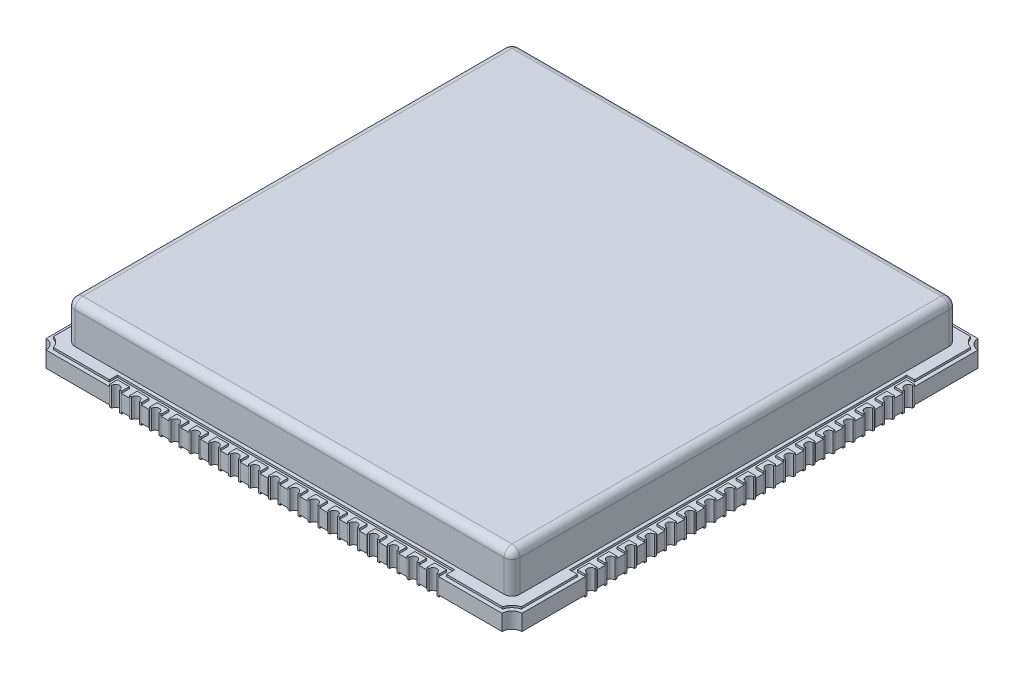
from build123d import *

# Parameters (mm, degrees)
SKETCH_1_W             = 24
SKETCH_1_H             = 24
EXTRUDE_1_DEPTH        = 1
SKETCH_3_R             = 0.5
SKETCH_3_W             = 0.2
SKETCH_3_H             = 0.6
SKETCH_3_W_2           = 0.6
SKETCH_3_H_2           = 0.2
CUT_EXTRUDE_3_DEPTH    = 18
SKETCH_4_OUTSIDE_W     = 32.792
SKETCH_4_OUTSIDE_H     = 32.792
CUT_EXTRUDE_4_DEPTH    = 0.1
SKETCH_5_OUTSIDE_W     = 32.792
SKETCH_5_OUTSIDE_H     = 32.792
SKETCH_5_OUTSIDE_R     = 1.5
SKETCH_5_OUTSIDE_R_2   = 0.75
CUT_EXTRUDE_5_DEPTH    = 0.1
EXTRUDE_7_DEPTH        = 0.3
EXTRUDE_8_DEPTH        = 0.3
PATTERN_LINEAR_1_COUNT = 17
PATTERN_LINEAR_1_PITCH = 1
PATTERN_LINEAR_2_COUNT = 17
PATTERN_LINEAR_2_PITCH = 1
SKETCH_11_R            = 0.2
CUT_EXTRUDE_9_DEPTH    = 18
SKETCH_12_R            = 0.55
SKETCH_12_R_2          = 1.3
EXTRUDE_10_DEPTH       = 0.1
SKETCH_2_W             = 22.44
SKETCH_2_H             = 22.44
EXTRUDE_2_DEPTH        = 2
FILLET_1_R             = 0.4


with BuildPart() as part:
    # Эскиз1 → Вытянуть1 (new body)
    with BuildSketch(Plane(origin=(0, 0, 0), x_dir=(1, 0, 0), z_dir=(0, 1, 0))):
        Rectangle(SKETCH_1_W, SKETCH_1_H)
    extrude(amount=EXTRUDE_1_DEPTH)

    # Эскиз3 → Вытянуть3 (cut, through all)
    with BuildSketch(Plane(origin=(0, 1, 0), x_dir=(1, 0, 0), z_dir=(0, 1, 0))):
        with Locations((-12, 12)):
            Circle(SKETCH_3_R)
        with Locations((12, 12)):
            Circle(SKETCH_3_R)
        with Locations((12, -12)):
            Circle(SKETCH_3_R)
        with Locations((-12, -12)):
            Circle(SKETCH_3_R)
        with Locations((-11.9, 8)):
            Rectangle(SKETCH_3_W, SKETCH_3_H)
        with Locations((-8, 11.9)):
            Rectangle(SKETCH_3_W_2, SKETCH_3_H_2)
        with Locations((-7, 11.9)):
            Rectangle(SKETCH_3_W_2, SKETCH_3_H_2)
        with Locations((-6, 11.9)):
            Rectangle(SKETCH_3_W_2, SKETCH_3_H_2)
        with Locations((-5, 11.9)):
            Rectangle(SKETCH_3_W_2, SKETCH_3_H_2)
        with Locations((-4, 11.9)):
            Rectangle(SKETCH_3_W_2, SKETCH_3_H_2)
        with Locations((-3, 11.9)):
            Rectangle(SKETCH_3_W_2, SKETCH_3_H_2)
        with Locations((-2, 11.9)):
            Rectangle(SKETCH_3_W_2, SKETCH_3_H_2)
        with Locations((-1, 11.9)):
            Rectangle(SKETCH_3_W_2, SKETCH_3_H_2)
        with Locations((0, 11.9)):
            Rectangle(SKETCH_3_W_2, SKETCH_3_H_2)
        with Locations((1, 11.9)):
            Rectangle(SKETCH_3_W_2, SKETCH_3_H_2)
        with Locations((2, 11.9)):
            Rectangle(SKETCH_3_W_2, SKETCH_3_H_2)
        with Locations((3, 11.9)):
            Rectangle(SKETCH_3_W_2, SKETCH_3_H_2)
        with Locations((4, 11.9)):
            Rectangle(SKETCH_3_W_2, SKETCH_3_H_2)
        with Locations((5, 11.9)):
            Rectangle(SKETCH_3_W_2, SKETCH_3_H_2)
        with Locations((6, 11.9)):
            Rectangle(SKETCH_3_W_2, SKETCH_3_H_2)
        with Locations((7, 11.9)):
            Rectangle(SKETCH_3_W_2, SKETCH_3_H_2)
        with Locations((8, 11.9)):
            Rectangle(SKETCH_3_W_2, SKETCH_3_H_2)
        with Locations((-8, -11.9)):
            Rectangle(SKETCH_3_W_2, SKETCH_3_H_2)
        with Locations((-7, -11.9)):
            Rectangle(SKETCH_3_W_2, SKETCH_3_H_2)
        with Locations((-6, -11.9)):
            Rectangle(SKETCH_3_W_2, SKETCH_3_H_2)
        with Locations((-5, -11.9)):
            Rectangle(SKETCH_3_W_2, SKETCH_3_H_2)
        with Locations((-4, -11.9)):
            Rectangle(SKETCH_3_W_2, SKETCH_3_H_2)
        with Locations((-3, -11.9)):
            Rectangle(SKETCH_3_W_2, SKETCH_3_H_2)
        with Locations((-2, -11.9)):
            Rectangle(SKETCH_3_W_2, SKETCH_3_H_2)
        with Locations((-1, -11.9)):
            Rectangle(SKETCH_3_W_2, SKETCH_3_H_2)
        with Locations((0, -11.9)):
            Rectangle(SKETCH_3_W_2, SKETCH_3_H_2)
        with Locations((1, -11.9)):
            Rectangle(SKETCH_3_W_2, SKETCH_3_H_2)
        with Locations((2, -11.9)):
            Rectangle(SKETCH_3_W_2, SKETCH_3_H_2)
        with Locations((3, -11.9)):
            Rectangle(SKETCH_3_W_2, SKETCH_3_H_2)
        with Locations((4, -11.9)):
            Rectangle(SKETCH_3_W_2, SKETCH_3_H_2)
        with Locations((5, -11.9)):
            Rectangle(SKETCH_3_W_2, SKETCH_3_H_2)
        with Locations((6, -11.9)):
            Rectangle(SKETCH_3_W_2, SKETCH_3_H_2)
        with Locations((7, -11.9)):
            Rectangle(SKETCH_3_W_2, SKETCH_3_H_2)
        with Locations((8, -11.9)):
            Rectangle(SKETCH_3_W_2, SKETCH_3_H_2)
        with Locations((11.9, 8)):
            Rectangle(SKETCH_3_W, SKETCH_3_H)
        with Locations((-11.9, 7)):
            Rectangle(SKETCH_3_W, SKETCH_3_H)
        with Locations((11.9, 7)):
            Rectangle(SKETCH_3_W, SKETCH_3_H)
        with Locations((-11.9, 6)):
            Rectangle(SKETCH_3_W, SKETCH_3_H)
        with Locations((11.9, 6)):
            Rectangle(SKETCH_3_W, SKETCH_3_H)
        with Locations((-11.9, 5)):
            Rectangle(SKETCH_3_W, SKETCH_3_H)
        with Locations((11.9, 5)):
            Rectangle(SKETCH_3_W, SKETCH_3_H)
        with Locations((-11.9, 4)):
            Rectangle(SKETCH_3_W, SKETCH_3_H)
        with Locations((11.9, 4)):
            Rectangle(SKETCH_3_W, SKETCH_3_H)
        with Locations((-11.9, 3)):
            Rectangle(SKETCH_3_W, SKETCH_3_H)
        with Locations((11.9, 3)):
            Rectangle(SKETCH_3_W, SKETCH_3_H)
        with Locations((-11.9, 2)):
            Rectangle(SKETCH_3_W, SKETCH_3_H)
        with Locations((11.9, 2)):
            Rectangle(SKETCH_3_W, SKETCH_3_H)
        with Locations((-11.9, 1)):
            Rectangle(SKETCH_3_W, SKETCH_3_H)
        with Locations((11.9, 1)):
            Rectangle(SKETCH_3_W, SKETCH_3_H)
        with Locations((-11.9, 0)):
            Rectangle(SKETCH_3_W, SKETCH_3_H)
        with Locations((11.9, 0)):
            Rectangle(SKETCH_3_W, SKETCH_3_H)
        with Locations((-11.9, -1)):
            Rectangle(SKETCH_3_W, SKETCH_3_H)
        with Locations((11.9, -1)):
            Rectangle(SKETCH_3_W, SKETCH_3_H)
        with Locations((-11.9, -2)):
            Rectangle(SKETCH_3_W, SKETCH_3_H)
        with Locations((11.9, -2)):
            Rectangle(SKETCH_3_W, SKETCH_3_H)
        with Locations((-11.9, -3)):
            Rectangle(SKETCH_3_W, SKETCH_3_H)
        with Locations((11.9, -3)):
            Rectangle(SKETCH_3_W, SKETCH_3_H)
        with Locations((-11.9, -4)):
            Rectangle(SKETCH_3_W, SKETCH_3_H)
        with Locations((11.9, -4)):
            Rectangle(SKETCH_3_W, SKETCH_3_H)
        with Locations((-11.9, -5)):
            Rectangle(SKETCH_3_W, SKETCH_3_H)
        with Locations((11.9, -5)):
            Rectangle(SKETCH_3_W, SKETCH_3_H)
        with Locations((-11.9, -6)):
            Rectangle(SKETCH_3_W, SKETCH_3_H)
        with Locations((11.9, -6)):
            Rectangle(SKETCH_3_W, SKETCH_3_H)
        with Locations((-11.9, -7)):
            Rectangle(SKETCH_3_W, SKETCH_3_H)
        with Locations((11.9, -7)):
            Rectangle(SKETCH_3_W, SKETCH_3_H)
        with Locations((-11.9, -8)):
            Rectangle(SKETCH_3_W, SKETCH_3_H)
        with Locations((11.9, -8)):
            Rectangle(SKETCH_3_W, SKETCH_3_H)
    extrude(amount=-CUT_EXTRUDE_3_DEPTH, mode=Mode.SUBTRACT)

    # Эскиз4 outside → Вытянуть4 (cut)
    with BuildSketch(Plane(origin=(0, 1, 0), x_dir=(1, 0, 0), z_dir=(0, 1, 0))):
        Rectangle(SKETCH_4_OUTSIDE_W, SKETCH_4_OUTSIDE_H)
        with BuildLine():
            Line((-11.8, -8.5), (-11.8, -11.329179607))
            ThreePointArc((-11.8, -11.329179607), (-11.505025253, -11.505025253), (-11.329179607, -11.8))
            Line((-11.329179607, -11.8), (-8.5, -11.8))
            Line((-8.5, -11.8), (-8.5, -11.4))
            Line((-8.5, -11.4), (8.5, -11.4))
            Line((8.5, -11.4), (8.5, -11.8))
            Line((8.5, -11.8), (11.329179607, -11.8))
            ThreePointArc((11.329179607, -11.8), (11.505025253, -11.505025253), (11.8, -11.329179607))
            Line((11.8, -11.329179607), (11.8, -8.5))
            Line((11.8, -8.5), (11.4, -8.5))
            Line((11.4, -8.5), (11.4, 8.5))
            Line((11.4, 8.5), (11.8, 8.5))
            Line((11.8, 8.5), (11.8, 11.329179607))
            ThreePointArc((11.8, 11.329179607), (11.505025253, 11.505025253), (11.329179607, 11.8))
            Line((11.329179607, 11.8), (8.5, 11.8))
            Line((8.5, 11.8), (8.5, 11.4))
            Line((8.5, 11.4), (-8.5, 11.4))
            Line((-8.5, 11.4), (-8.5, 11.8))
            Line((-8.5, 11.8), (-11.329179607, 11.8))
            ThreePointArc((-11.329179607, 11.8), (-11.505025253, 11.505025253), (-11.8, 11.329179607))
            Line((-11.8, 11.329179607), (-11.8, 8.5))
            Line((-11.8, 8.5), (-11.4, 8.5))
            Line((-11.4, 8.5), (-11.4, -8.5))
            Line((-11.4, -8.5), (-11.8, -8.5))
        make_face(mode=Mode.SUBTRACT)
    extrude(amount=-CUT_EXTRUDE_4_DEPTH, mode=Mode.SUBTRACT)

    # Эскиз5 outside → Вытянуть5 (cut)
    # profile 1 of 11: a face of its own
    with BuildSketch(Plane.XZ):
        Rectangle(SKETCH_5_OUTSIDE_W, SKETCH_5_OUTSIDE_H)
        with BuildLine():
            Line((-8.5, -10.8), (8.5, -10.8))
            Line((8.5, -10.8), (8.5, -11.8))
            Line((8.5, -11.8), (11.329179607, -11.8))
            ThreePointArc((11.329179607, -11.8), (11.505025253, -11.505025253), (11.8, -11.329179607))
            Line((11.8, -11.329179607), (11.8, -8.5))
            Line((11.8, -8.5), (10.8, -8.5))
            Line((10.8, -8.5), (10.8, 8.5))
            Line((10.8, 8.5), (11.8, 8.5))
            Line((11.8, 8.5), (11.8, 11.329179607))
            ThreePointArc((11.8, 11.329179607), (11.505025253, 11.505025253), (11.329179607, 11.8))
            Line((11.329179607, 11.8), (8.5, 11.8))
            Line((8.5, 11.8), (8.5, 10.8))
            Line((8.5, 10.8), (-8.5, 10.8))
            Line((-8.5, 10.8), (-8.5, 11.8))
            Line((-8.5, 11.8), (-11.329179607, 11.8))
            ThreePointArc((-11.329179607, 11.8), (-11.505025253, 11.505025253), (-11.8, 11.329179607))
            Line((-11.8, 11.329179607), (-11.8, 8.5))
            Line((-11.8, 8.5), (-10.8, 8.5))
            Line((-10.8, 8.5), (-10.8, -8.5))
            Line((-10.8, -8.5), (-11.8, -8.5))
            Line((-11.8, -8.5), (-11.8, -11.329179607))
            ThreePointArc((-11.8, -11.329179607), (-11.505025253, -11.505025253), (-11.329179607, -11.8))
            Line((-11.329179607, -11.8), (-8.5, -11.8))
            Line((-8.5, -11.8), (-8.5, -10.8))
        make_face(mode=Mode.SUBTRACT)
    # profile 2 of 11: a face of its own
    with BuildSketch(Plane.XZ):
        with Locations((-0.5, -8)):
            Circle(SKETCH_5_OUTSIDE_R)
    # profile 3 of 11: a face of its own
    with BuildSketch(Plane.XZ):
        with Locations((-6.5, 2)):
            Circle(SKETCH_5_OUTSIDE_R_2)
    # profile 4 of 11: a face of its own
    with BuildSketch(Plane.XZ):
        with Locations((-4.5, 2)):
            Circle(SKETCH_5_OUTSIDE_R_2)
    # profile 5 of 11: a face of its own
    with BuildSketch(Plane.XZ):
        with Locations((-2.5, 2)):
            Circle(SKETCH_5_OUTSIDE_R_2)
    # profile 6 of 11: a face of its own
    with BuildSketch(Plane.XZ):
        with Locations((-6.5, 0)):
            Circle(SKETCH_5_OUTSIDE_R_2)
    # profile 7 of 11: a face of its own
    with BuildSketch(Plane.XZ):
        with Locations((-4.5, 0)):
            Circle(SKETCH_5_OUTSIDE_R_2)
    # profile 8 of 11: a face of its own
    with BuildSketch(Plane.XZ):
        with Locations((-2.5, 0)):
            Circle(SKETCH_5_OUTSIDE_R_2)
    # profile 9 of 11: a face of its own
    with BuildSketch(Plane.XZ):
        with Locations((-6.5, -2)):
            Circle(SKETCH_5_OUTSIDE_R_2)
    # profile 10 of 11: a face of its own
    with BuildSketch(Plane.XZ):
        with Locations((-4.5, -2)):
            Circle(SKETCH_5_OUTSIDE_R_2)
    # profile 11 of 11: a face of its own
    with BuildSketch(Plane.XZ):
        with Locations((-2.5, -2)):
            Circle(SKETCH_5_OUTSIDE_R_2)
    extrude(amount=-CUT_EXTRUDE_5_DEPTH, mode=Mode.SUBTRACT)

    # Эскиз9 → Вытянуть7 (add, symmetric)
    with BuildSketch(Plane.XY.offset(-8)):
        Polygon((-11.99, 1), (-11.99, 0), (-11, 0), (-11, 0.1), (-11.6, 0.1), (-11.6, 1), align=None)
        Polygon((11.6, 1), (11.99, 1), (11.99, 0), (11, 0), (11, 0.1), (11.6, 0.1), align=None)
    extrude_7 = extrude(amount=EXTRUDE_7_DEPTH, both=True)

    # Эскиз10 → Вытянуть8 (add, symmetric)
    with BuildSketch(Plane(origin=(-8, 0, 0), x_dir=(0, 0, -1), z_dir=(1, 0, 0))):
        Polygon((11.6, 0.1), (11.6, 1), (11.99, 1), (11.99, 0), (11, 0), (11, 0.1), align=None)
        Polygon((-11, 0.1), (-11.6, 0.1), (-11.6, 1), (-11.99, 1), (-11.99, 0), (-11, 0), align=None)
    extrude_8 = extrude(amount=EXTRUDE_8_DEPTH, both=True)

    # Линейный массив1: Вытянуть7 ×17
    with Locations(*[(0, 0, i * PATTERN_LINEAR_1_PITCH) for i in range(1, PATTERN_LINEAR_1_COUNT)]):
        add(extrude_7)

    # Линейный массив2: Вытянуть8 ×17
    with Locations(*[(i * PATTERN_LINEAR_2_PITCH, 0, 0) for i in range(1, PATTERN_LINEAR_2_COUNT)]):
        add(extrude_8)

    # Эскиз11 → Вытянуть9 (cut, through all)
    with BuildSketch(Plane(origin=(0, 1, 0), x_dir=(1, 0, 0), z_dir=(0, 1, 0))):
        with Locations((-11.99, 8)):
            Circle(SKETCH_11_R)
        with Locations((-8, 11.99)):
            Circle(SKETCH_11_R)
        with Locations((11.99, 8)):
            Circle(SKETCH_11_R)
        with Locations((-11.99, 7)):
            Circle(SKETCH_11_R)
        with Locations((11.99, 7)):
            Circle(SKETCH_11_R)
        with Locations((-11.99, 6)):
            Circle(SKETCH_11_R)
        with Locations((11.99, 6)):
            Circle(SKETCH_11_R)
        with Locations((-11.99, 5)):
            Circle(SKETCH_11_R)
        with Locations((11.99, 5)):
            Circle(SKETCH_11_R)
        with Locations((-11.99, 4)):
            Circle(SKETCH_11_R)
        with Locations((11.99, 4)):
            Circle(SKETCH_11_R)
        with Locations((-11.99, 3)):
            Circle(SKETCH_11_R)
        with Locations((11.99, 3)):
            Circle(SKETCH_11_R)
        with Locations((-11.99, 2)):
            Circle(SKETCH_11_R)
        with Locations((11.99, 2)):
            Circle(SKETCH_11_R)
        with Locations((-11.99, 1)):
            Circle(SKETCH_11_R)
        with Locations((11.99, 1)):
            Circle(SKETCH_11_R)
        with Locations((-11.99, 0)):
            Circle(SKETCH_11_R)
        with Locations((11.99, 0)):
            Circle(SKETCH_11_R)
        with Locations((-11.99, -1)):
            Circle(SKETCH_11_R)
        with Locations((11.99, -1)):
            Circle(SKETCH_11_R)
        with Locations((-11.99, -2)):
            Circle(SKETCH_11_R)
        with Locations((11.99, -2)):
            Circle(SKETCH_11_R)
        with Locations((-11.99, -3)):
            Circle(SKETCH_11_R)
        with Locations((11.99, -3)):
            Circle(SKETCH_11_R)
        with Locations((-11.99, -4)):
            Circle(SKETCH_11_R)
        with Locations((11.99, -4)):
            Circle(SKETCH_11_R)
        with Locations((-11.99, -5)):
            Circle(SKETCH_11_R)
        with Locations((11.99, -5)):
            Circle(SKETCH_11_R)
        with Locations((-11.99, -6)):
            Circle(SKETCH_11_R)
        with Locations((11.99, -6)):
            Circle(SKETCH_11_R)
        with Locations((-11.99, -7)):
            Circle(SKETCH_11_R)
        with Locations((11.99, -7)):
            Circle(SKETCH_11_R)
        with Locations((-11.99, -8)):
            Circle(SKETCH_11_R)
        with Locations((11.99, -8)):
            Circle(SKETCH_11_R)
        with Locations((-7, 11.99)):
            Circle(SKETCH_11_R)
        with Locations((-6, 11.99)):
            Circle(SKETCH_11_R)
        with Locations((-5, 11.99)):
            Circle(SKETCH_11_R)
        with Locations((-4, 11.99)):
            Circle(SKETCH_11_R)
        with Locations((-3, 11.99)):
            Circle(SKETCH_11_R)
        with Locations((-2, 11.99)):
            Circle(SKETCH_11_R)
        with Locations((-1, 11.99)):
            Circle(SKETCH_11_R)
        with Locations((0, 11.99)):
            Circle(SKETCH_11_R)
        with Locations((1, 11.99)):
            Circle(SKETCH_11_R)
        with Locations((2, 11.99)):
            Circle(SKETCH_11_R)
        with Locations((3, 11.99)):
            Circle(SKETCH_11_R)
        with Locations((4, 11.99)):
            Circle(SKETCH_11_R)
        with Locations((5, 11.99)):
            Circle(SKETCH_11_R)
        with Locations((6, 11.99)):
            Circle(SKETCH_11_R)
        with Locations((7, 11.99)):
            Circle(SKETCH_11_R)
        with Locations((8, 11.99)):
            Circle(SKETCH_11_R)
        with Locations((-8, -11.99)):
            Circle(SKETCH_11_R)
        with Locations((-7, -11.99)):
            Circle(SKETCH_11_R)
        with Locations((-6, -11.99)):
            Circle(SKETCH_11_R)
        with Locations((-5, -11.99)):
            Circle(SKETCH_11_R)
        with Locations((-4, -11.99)):
            Circle(SKETCH_11_R)
        with Locations((-3, -11.99)):
            Circle(SKETCH_11_R)
        with Locations((-2, -11.99)):
            Circle(SKETCH_11_R)
        with Locations((-1, -11.99)):
            Circle(SKETCH_11_R)
        with Locations((0, -11.99)):
            Circle(SKETCH_11_R)
        with Locations((1, -11.99)):
            Circle(SKETCH_11_R)
        with Locations((2, -11.99)):
            Circle(SKETCH_11_R)
        with Locations((3, -11.99)):
            Circle(SKETCH_11_R)
        with Locations((4, -11.99)):
            Circle(SKETCH_11_R)
        with Locations((5, -11.99)):
            Circle(SKETCH_11_R)
        with Locations((6, -11.99)):
            Circle(SKETCH_11_R)
        with Locations((7, -11.99)):
            Circle(SKETCH_11_R)
        with Locations((8, -11.99)):
            Circle(SKETCH_11_R)
    extrude(amount=-CUT_EXTRUDE_9_DEPTH, mode=Mode.SUBTRACT)

    # Эскиз12 → Вытянуть10 (add)
    with BuildSketch(Plane.XZ.offset(-0.1)):
        with Locations((-2.5, 2)):
            Circle(SKETCH_12_R)
        with Locations((-2.5, 0)):
            Circle(SKETCH_12_R)
        with Locations((-4.5, 0)):
            Circle(SKETCH_12_R)
        with Locations((-4.5, 2)):
            Circle(SKETCH_12_R)
        with Locations((-6.5, 2)):
            Circle(SKETCH_12_R)
        with Locations((-6.5, 0)):
            Circle(SKETCH_12_R)
        with Locations((-6.5, -2)):
            Circle(SKETCH_12_R)
        with Locations((-4.5, -2)):
            Circle(SKETCH_12_R)
        with Locations((-2.5, -2)):
            Circle(SKETCH_12_R)
        with Locations((-0.5, -8)):
            Circle(SKETCH_12_R_2)
    extrude(amount=EXTRUDE_10_DEPTH)

    # Эскиз2 → Вытянуть2 (add)
    with BuildSketch(Plane(origin=(0, 1, 0), x_dir=(1, 0, 0), z_dir=(0, 1, 0))):
        Rectangle(SKETCH_2_W, SKETCH_2_H)
    extrude(amount=EXTRUDE_2_DEPTH)

    # Скругление1
    fillet_1_edges = [part.edges().sort_by_distance(p)[0] for p in [
        (0, 3, -11.22),
        (11.22, 3, 0),
        (0, 3, 11.22),
        (-11.22, 3, 0),
        (-11.22, 2, -11.22),
        (11.22, 2, -11.22),
        (11.22, 2, 11.22),
        (-11.22, 2, 11.22),
    ]]
    fillet(fillet_1_edges, radius=FILLET_1_R)


solid = part.part
